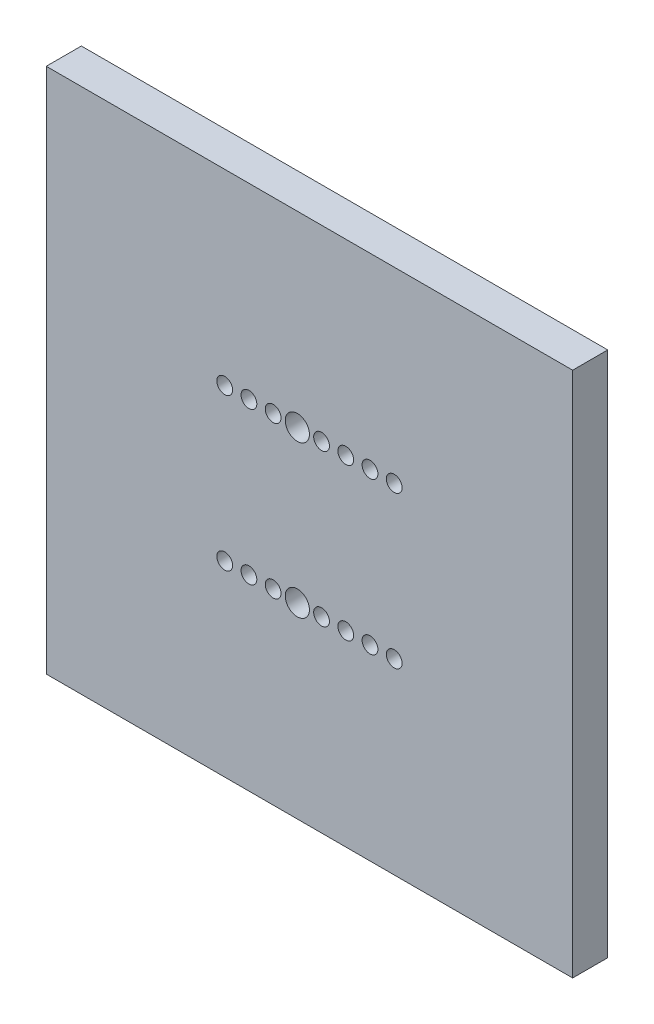
from build123d import *

# Parameters (mm, degrees)
ESQUISSE2_W             = 30
ESQUISSE2_H             = 30
BOSS_EXTRU_1_DEPTH      = 2
ESQUISSE3_R             = 0.45
ESQUISSE3_R_2           = 0.69
ENL_V_MAT_EXTRU_1_DEPTH = 10


with BuildPart() as part:
    # Esquisse2 → Boss.-Extru.1 (new body)
    with BuildSketch(Plane.XY):
        Rectangle(ESQUISSE2_W, ESQUISSE2_H)
    extrude(amount=BOSS_EXTRU_1_DEPTH)

    # Esquisse3 → Enlèv. mat.-Extru.1 (cut)
    with BuildSketch(Plane.XY.offset(2)):
        with Locations((-4.83, -4.33)):
            Circle(ESQUISSE3_R)
        with Locations((-4.83, 4.33)):
            Circle(ESQUISSE3_R)
        with Locations((-3.45, -4.33)):
            Circle(ESQUISSE3_R)
        with Locations((-3.45, 4.33)):
            Circle(ESQUISSE3_R)
        with Locations((-2.07, -4.33)):
            Circle(ESQUISSE3_R)
        with Locations((-2.07, 4.33)):
            Circle(ESQUISSE3_R)
        with Locations((-0.69, -4.33)):
            Circle(ESQUISSE3_R_2)
        with Locations((-0.69, 4.33)):
            Circle(ESQUISSE3_R_2)
        with Locations((0.69, -4.33)):
            Circle(ESQUISSE3_R)
        with Locations((0.69, 4.33)):
            Circle(ESQUISSE3_R)
        with Locations((2.07, -4.33)):
            Circle(ESQUISSE3_R)
        with Locations((2.07, 4.33)):
            Circle(ESQUISSE3_R)
        with Locations((3.45, -4.33)):
            Circle(ESQUISSE3_R)
        with Locations((3.45, 4.33)):
            Circle(ESQUISSE3_R)
        with Locations((4.83, -4.33)):
            Circle(ESQUISSE3_R)
        with Locations((4.83, 4.33)):
            Circle(ESQUISSE3_R)
    extrude(amount=-ENL_V_MAT_EXTRU_1_DEPTH, mode=Mode.SUBTRACT)


solid = part.part
